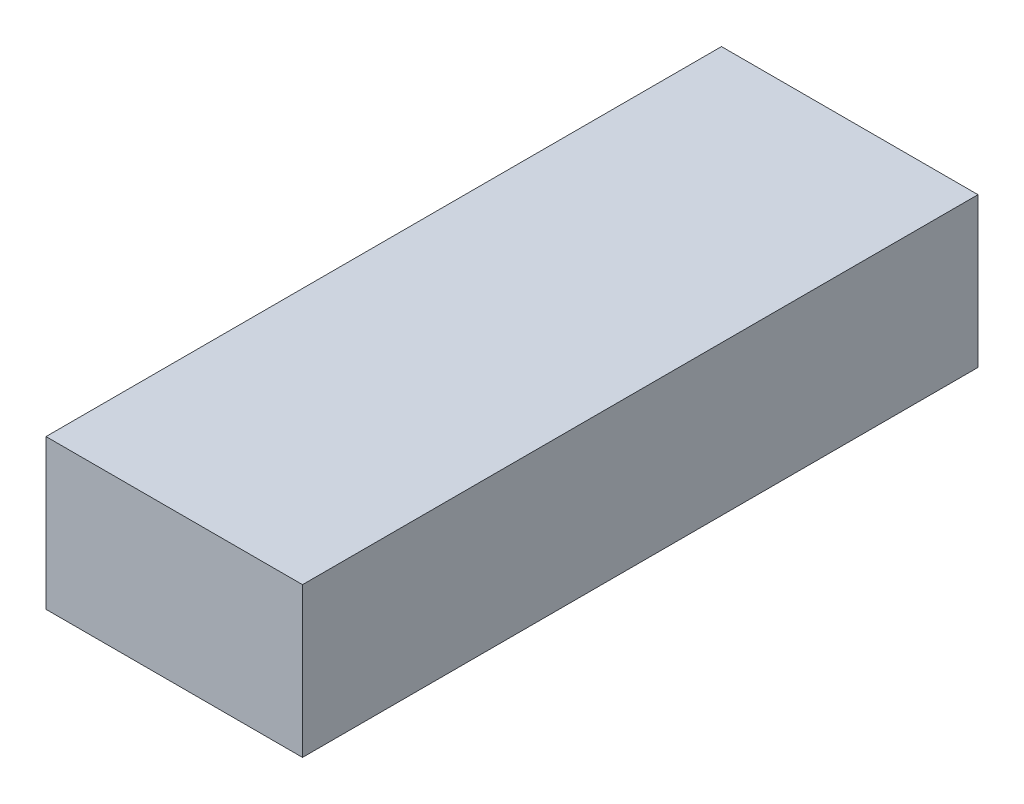
from build123d import *

# Parameters (mm, degrees)
BOSS_EXTRUDE1_DEPTH = 4.445


with BuildPart() as part:
    # Sketch1 → Boss-Extrude1 (new body)
    with BuildSketch(Plane(origin=(0, 0, 0), x_dir=(1, 0, 0), z_dir=(0, 1, 0))):
        Polygon((6.223, 7.62), (6.223, 0), (6.223, -6.223), (13.843, -6.223), (13.843, 0), (13.843, 7.62), (13.843, 13.843), (6.223, 13.843), align=None)
    extrude(amount=BOSS_EXTRUDE1_DEPTH)


solid = part.part
